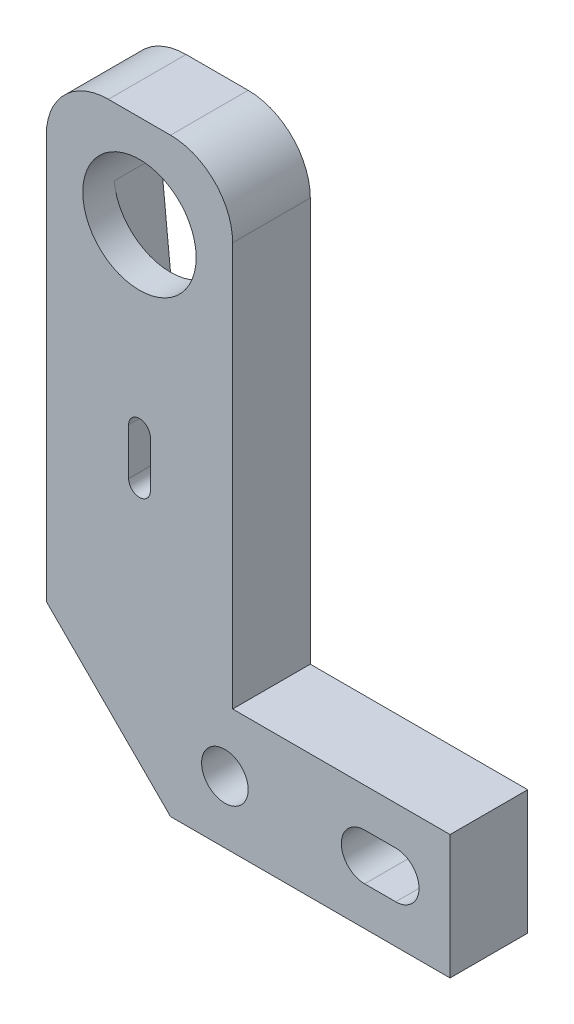
from build123d import *

# Parameters (mm, degrees)
ESBO_O1_R                = 1.5
ESBO_O1_R_2              = 3.65
RESSALTO_EXTRUS_O1_DEPTH = 5
CORTE_EXTRUS_O1_DEPTH    = 3


with BuildPart() as part:
    # Esboço1 → Ressalto-extrusão1 (new body)
    with BuildSketch(Plane.XY):
        with BuildLine():
            ThreePointArc((-2, 6), (-4.828427125, 4.828427125), (-6, 2))
            Line((-6, 2), (-6, -24))
            Line((-6, -24), (2, -32))
            Line((2, -32), (20, -32))
            Line((20, -32), (20, -24))
            Line((20, -24), (6, -24))
            Line((6, -24), (6, 2))
            ThreePointArc((6, 2), (4.828427125, 4.828427125), (2, 6))
            Line((2, 6), (-2, 6))
        make_face()
        with Locations((5.5, -28)):
            Circle(ESBO_O1_R, mode=Mode.SUBTRACT)
        with BuildLine():
            Line((14.5, -26.5), (16.5, -26.5))
            ThreePointArc((16.5, -26.5), (18, -28), (16.5, -29.5))
            Line((16.5, -29.5), (14.5, -29.5))
            ThreePointArc((14.5, -29.5), (13, -28), (14.5, -26.5))
        make_face(mode=Mode.SUBTRACT)
        Circle(ESBO_O1_R_2, mode=Mode.SUBTRACT)
        with BuildLine():
            Line((0.7, -11.5), (0.7, -14.5))
            ThreePointArc((0.7, -14.5), (0, -15.2), (-0.7, -14.5))
            Line((-0.7, -14.5), (-0.7, -11.5))
            ThreePointArc((-0.7, -11.5), (0, -10.8), (0.7, -11.5))
        make_face(mode=Mode.SUBTRACT)
    extrude(amount=RESSALTO_EXTRUS_O1_DEPTH)

    # Esboço1<3> → Corte-extrusão1 (cut)
    with BuildSketch(Plane.XY):
        with BuildLine():
            ThreePointArc((-2.238721733, -14.225), (0, -16.25), (2.238721733, -14.225))
            Line((2.238721733, -14.225), (3.631704145, -0.365))
            ThreePointArc((3.631704145, -0.365), (0, -3.65), (-3.631704145, -0.365))
            Line((-3.631704145, -0.365), (-2.238721733, -14.225))
        make_face()
        with BuildLine():
            ThreePointArc((0.7, -14.5), (0, -15.2), (-0.7, -14.5))
            Line((-0.7, -14.5), (-0.7, -11.5))
            ThreePointArc((-0.7, -11.5), (0, -10.8), (0.7, -11.5))
            Line((0.7, -11.5), (0.7, -14.5))
        make_face(mode=Mode.SUBTRACT)
    extrude(amount=CORTE_EXTRUS_O1_DEPTH, mode=Mode.SUBTRACT)


solid = part.part
